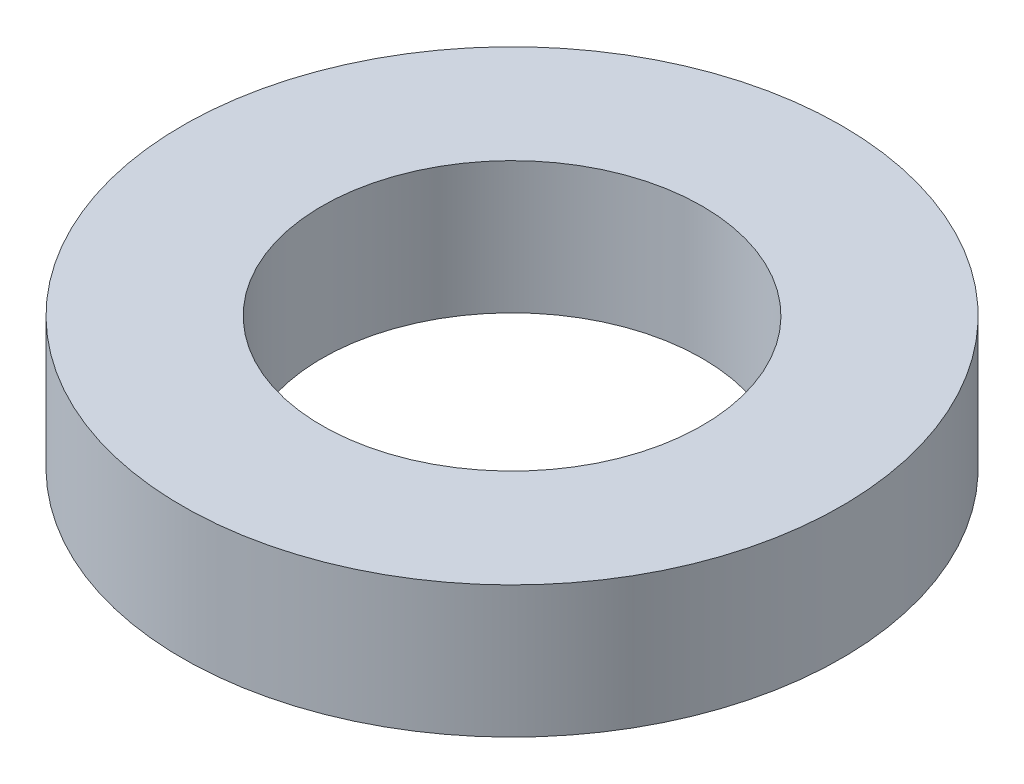
from build123d import *

# Parameters (mm, degrees)
SKETCH1_R           = 65
BOSS_EXTRUDE1_DEPTH = 26
SKETCH2_R           = 37.5
CUT_EXTRUDE1_DEPTH  = 96.530099969


with BuildPart() as part:
    # Sketch1 → Boss-Extrude1 (new body)
    with BuildSketch(Plane(origin=(0, 0, 0), x_dir=(1, 0, 0), z_dir=(0, 1, 0))):
        Circle(SKETCH1_R)
    extrude(amount=BOSS_EXTRUDE1_DEPTH)

    # Sketch2 → Cut-Extrude1 (cut, through all)
    with BuildSketch(Plane(origin=(0, 0, 0), x_dir=(1, 0, 0), z_dir=(0, 1, 0))):
        Circle(SKETCH2_R)
    extrude(amount=CUT_EXTRUDE1_DEPTH, mode=Mode.SUBTRACT)


solid = part.part
